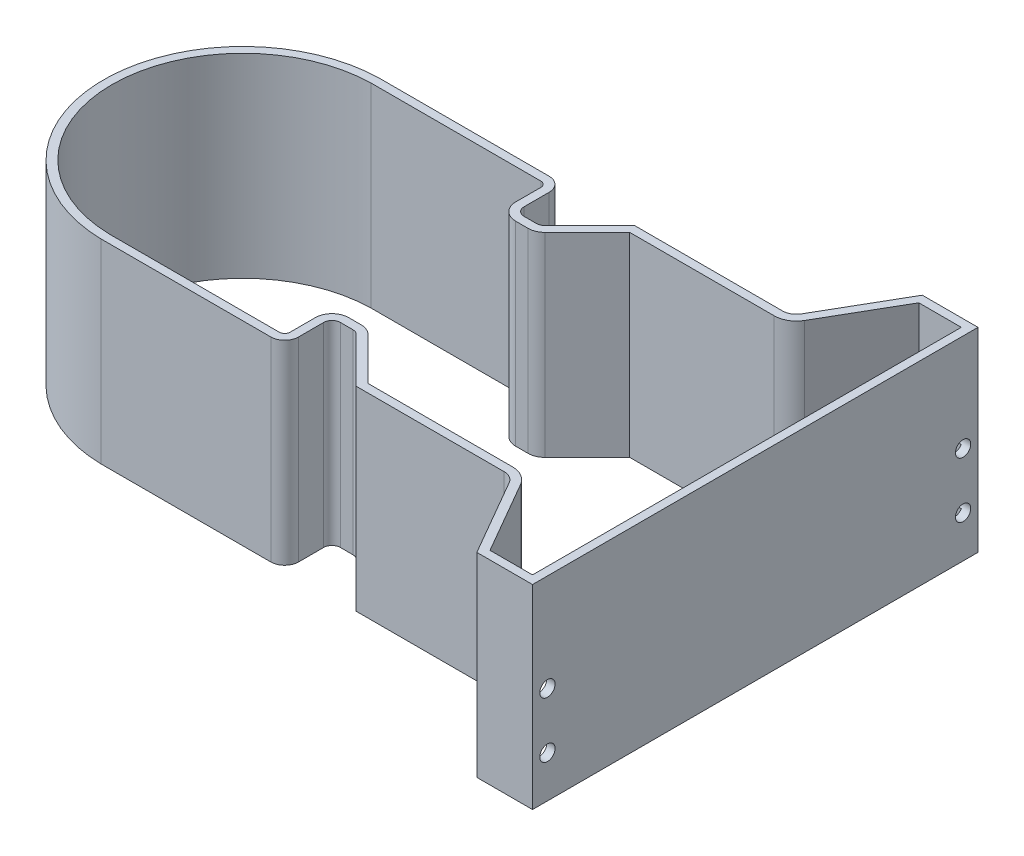
from build123d import *

# Parameters (mm, degrees)
BOSS_EXTRUDE1_DEPTH = 70
CUT_EXTRUDE2_DEPTH  = 172.263863573
CUT_EXTRUDE3_DEPTH  = 70
SKETCH3_R           = 2.75
CUT_EXTRUDE6_DEPTH  = 5


with BuildPart() as part:
    # Sketch1 → Boss-Extrude1 (new body)
    with BuildSketch(Plane(origin=(0, 0, 0), x_dir=(1, 0, 0), z_dir=(0, 1, 0))):
        with BuildLine():
            Line((15.254575611, 35.990242765), (15.254575611, 44.990242765))
            ThreePointArc((15.254575611, 44.990242765), (13.790109517, 48.525776671), (10.254575611, 49.990242765))
            Line((10.254575611, 49.990242765), (-50.745424389, 49.990242765))
            ThreePointArc((-50.745424389, 49.990242765), (-99.757685432, 0), (-50.745424389, -49.990242765))
            Line((-50.745424389, -49.990242765), (10.254575611, -49.990242765))
            ThreePointArc((10.254575611, -49.990242765), (13.790109517, -48.525776671), (15.254575611, -44.990242765))
            Line((15.254575611, -44.990242765), (15.254575611, -35.990242765))
            ThreePointArc((15.254575611, -35.990242765), (16.133255268, -33.868922422), (18.254575611, -32.990242765))
            Line((18.254575611, -32.990242765), (22.711934924, -32.990242765))
            ThreePointArc((22.711934924, -32.990242765), (23.859985221, -33.218604168), (24.833255268, -33.868922422))
            Line((24.833255268, -33.868922422), (40.954575611, -49.990242765))
            Line((40.954575611, -49.990242765), (50.745424389, -49.990242765))
            Line((50.745424389, -49.990242765), (94.067824265, -49.990242765))
            ThreePointArc((94.067824265, -49.990242765), (96.567824265, -50.660115747), (98.397951284, -52.490242765))
            Line((98.397951284, -52.490242765), (114.280717029, -80))
            Line((114.280717029, -80), (134.280717029, -80))
            Line((134.280717029, -80), (134.280717029, 80))
            Line((134.280717029, 80), (114.280717029, 80))
            Line((114.280717029, 80), (98.397951284, 52.490242765))
            ThreePointArc((98.397951284, 52.490242765), (96.567824265, 50.660115747), (94.067824265, 49.990242765))
            Line((94.067824265, 49.990242765), (50.745424389, 49.990242765))
            Line((50.745424389, 49.990242765), (40.954575611, 49.990242765))
            Line((40.954575611, 49.990242765), (24.833255268, 33.868922422))
            ThreePointArc((24.833255268, 33.868922422), (23.859985221, 33.218604168), (22.711934924, 32.990242765))
            Line((22.711934924, 32.990242765), (18.254575611, 32.990242765))
            ThreePointArc((18.254575611, 32.990242765), (16.133255268, 33.868922422), (15.254575611, 35.990242765))
        make_face()
    extrude(amount=BOSS_EXTRUDE1_DEPTH)

    # Sketch4 → Cut-Extrude2 (cut, through all)
    with BuildSketch(Plane(origin=(0, 70, 0), x_dir=(1, 0, 0), z_dir=(0, 1, 0))):
        with BuildLine():
            Line((22.711934924, 21), (13.711934924, 21))
            ThreePointArc((13.711934924, 21), (11.590614581, 20.121320344), (10.711934924, 18))
            Line((10.711934924, 18), (10.711934924, -18))
            ThreePointArc((10.711934924, -18), (11.590614581, -20.121320344), (13.711934924, -21))
            Line((13.711934924, -21), (22.711934924, -21))
            Line((22.711934924, -21), (22.711934924, 21))
        make_face()
    extrude(amount=-CUT_EXTRUDE2_DEPTH, mode=Mode.SUBTRACT)

    # Sketch5 → Cut-Extrude3 (cut)
    with BuildSketch(Plane(origin=(0, 70, 0), x_dir=(1, 0, 0), z_dir=(0, 1, 0))):
        with BuildLine():
            Line((116.012767836, 77), (100.996027496, 50.990242765))
            ThreePointArc((100.996027496, 50.990242765), (98.067824265, 48.062039535), (94.067824265, 46.990242765))
            Line((94.067824265, 46.990242765), (42.197216298, 46.990242765))
            Line((42.197216298, 46.990242765), (26.954575611, 31.747602078))
            ThreePointArc((26.954575611, 31.747602078), (25.008035518, 30.44696557), (22.711934924, 29.990242765))
            Line((22.711934924, 29.990242765), (18.254575611, 29.990242765))
            ThreePointArc((18.254575611, 29.990242765), (14.011934924, 31.747602078), (12.254575611, 35.990242765))
            Line((12.254575611, 35.990242765), (12.254575611, 44.990242765))
            ThreePointArc((12.254575611, 44.990242765), (11.668789174, 46.404456328), (10.254575611, 46.990242765))
            Line((10.254575611, 46.990242765), (-50.715330899, 46.990242765))
            ThreePointArc((-50.715330899, 46.990242765), (-96.757685432, 0), (-50.715330899, -46.990242765))
            Line((-50.715330899, -46.990242765), (10.254575611, -46.990242765))
            ThreePointArc((10.254575611, -46.990242765), (11.668789174, -46.404456328), (12.254575611, -44.990242765))
            Line((12.254575611, -44.990242765), (12.254575611, -35.990242765))
            ThreePointArc((12.254575611, -35.990242765), (14.011934924, -31.747602078), (18.254575611, -29.990242765))
            Line((18.254575611, -29.990242765), (22.711934924, -29.990242765))
            ThreePointArc((22.711934924, -29.990242765), (25.008035518, -30.44696557), (26.954575611, -31.747602078))
            Line((26.954575611, -31.747602078), (42.197216298, -46.990242765))
            Line((42.197216298, -46.990242765), (94.067824265, -46.990242765))
            ThreePointArc((94.067824265, -46.990242765), (98.067824265, -48.062039535), (100.996027496, -50.990242765))
            Line((100.996027496, -50.990242765), (116.012767836, -77))
            Line((116.012767836, -77), (131.280717029, -77))
            Line((131.280717029, -77), (131.280717029, 77))
            Line((131.280717029, 77), (116.012767836, 77))
        make_face()
    extrude(amount=-CUT_EXTRUDE3_DEPTH, mode=Mode.SUBTRACT)

    # Sketch3 → Cut-Extrude6 (cut)
    with BuildSketch(Plane(origin=(134.280717029, 0, 0), x_dir=(0, 0, -1), z_dir=(1, 0, 0))):
        with Locations((-74.64699859, 15)):
            Circle(SKETCH3_R)
        with Locations((-74.64699859, 35)):
            Circle(SKETCH3_R)
        with Locations((74.64699859, 35)):
            Circle(SKETCH3_R)
        with Locations((74.64699859, 15)):
            Circle(SKETCH3_R)
    extrude(amount=-CUT_EXTRUDE6_DEPTH, mode=Mode.SUBTRACT)


solid = part.part
